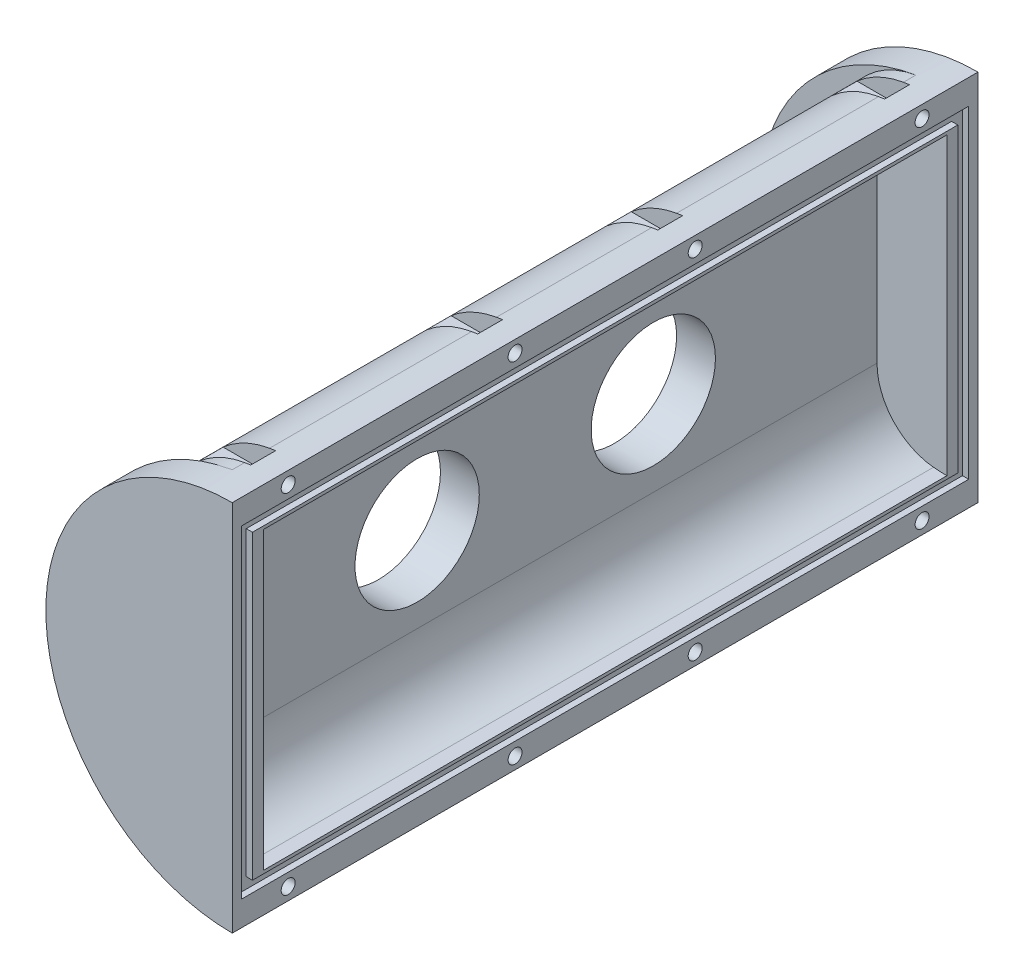
from build123d import *

# Parameters (mm, degrees)
BOSS_EXTRUDE1_DEPTH            = 110
BOSS_EXTRUDE3_START            = -110
BOSS_EXTRUDE3_DEPTH            = 10
SKETCH11_W                     = 8
SKETCH11_H                     = 7.702958
SKETCH11_H_2                   = 8
CUT_EXTRUDE1_DEPTH             = 51
M4_CLEARANCE_HOLE1_D           = 4.5
M4_CLEARANCE_HOLE1_CSINK_D     = 4.55
M4_CLEARANCE_HOLE1_CSINK_ANGLE = 90
CUT_EXTRUDE2_START             = -20
SKETCH14_R                     = 20
CUT_EXTRUDE2_DEPTH             = 48
CUT_EXTRUDE3_DEPTH             = 2
SKETCH22_W                     = 5
SKETCH22_H                     = 6


with BuildPart() as part:
    # Sketch1 → Boss-Extrude1 (new body)
    with BuildSketch(Plane.XY):
        with BuildLine():
            Line((0, 52), (-2, 52))
            Line((-2, 52), (-2, 48.5))
            Line((-2, 48.5), (0, 48.5))
            Line((0, 48.5), (0, 47.5))
            ThreePointArc((0, 47.5), (-2.161329, 47.450802), (-4.318182, 47.303312))
            ThreePointArc((-4.318182, 47.303312), (-17.270979, 40.870125), (-22.5, 27.386128))
            Line((-22.5, 27.386128), (-22.5, -27.386128))
            ThreePointArc((-22.5, -27.386128), (-17.270979, -40.870125), (-4.318182, -47.303312))
            ThreePointArc((-4.318182, -47.303312), (-2.161329, -47.450802), (0, -47.5))
            Line((0, -47.5), (0, -48.5))
            Line((0, -48.5), (-2, -48.5))
            Line((-2, -48.5), (-2, -52))
            Line((-2, -52), (0, -52))
            Line((0, -52), (0, -60))
            ThreePointArc((0, -60), (-5.017576, -59.789831), (-10, -59.160798))
            ThreePointArc((-10, -59.160798), (-27.912878, -48.945316), (-35, -29.580399))
            Line((-35, -29.580399), (-35, 29.580399))
            ThreePointArc((-35, 29.580399), (-27.912878, 48.945316), (-10, 59.160798))
            ThreePointArc((-10, 59.160798), (-5.017576, 59.789831), (0, 60))
            Line((0, 60), (0, 52))
        make_face()
    boss_extrude1 = extrude(amount=-BOSS_EXTRUDE1_DEPTH)

    # Sketch7 → Boss-Extrude3 (add)
    with BuildSketch(Plane.XY.offset(BOSS_EXTRUDE3_START)):
        with BuildLine():
            Line((0, 60), (0, -60))
            ThreePointArc((0, -60), (-60, 0), (0, 60))
        make_face()
    boss_extrude3 = extrude(amount=-BOSS_EXTRUDE3_DEPTH)

    # Sketch11 → Cut-Extrude1 (cut)
    with BuildSketch(Plane(origin=(-59.040249, 0, 0), x_dir=(0, 0, -1), z_dir=(-1, 0, 0))):
        with Locations((28.984104, 56.148521)):
            Rectangle(SKETCH11_W, SKETCH11_H)
        with Locations((102, 56)):
            Rectangle(SKETCH11_W, SKETCH11_H_2)
        with Locations((28.984104, -56.148521)):
            Rectangle(SKETCH11_W, SKETCH11_H)
        with Locations((102, -56)):
            Rectangle(SKETCH11_W, SKETCH11_H_2)
    cut_extrude1 = extrude(amount=-CUT_EXTRUDE1_DEPTH, mode=Mode.SUBTRACT)

    # M4 Clearance Hole1 (through all)
    with Locations(Plane.ZY.offset(35)):
        with Locations((-28.984104, -56.148521), (-102, 56), (-28.984104, 56.148521), (-102, -56)):
            m4_clearance_hole1 = CounterSinkHole(M4_CLEARANCE_HOLE1_D / 2, M4_CLEARANCE_HOLE1_CSINK_D / 2, counter_sink_angle=M4_CLEARANCE_HOLE1_CSINK_ANGLE)

    # Sketch14 → Cut-Extrude2 (cut)
    with BuildSketch(Plane(origin=(0, 0, 0), x_dir=(0, 0, -1), z_dir=(1, 0, 0)).offset(CUT_EXTRUDE2_START)):
        with Locations((38, 0)):
            Circle(SKETCH14_R)
    cut_extrude2 = extrude(amount=-CUT_EXTRUDE2_DEPTH, mode=Mode.SUBTRACT)

    # Sketch8 → Cut-Extrude3 (cut)
    with BuildSketch(Plane(origin=(0, 0, 0), x_dir=(0, 0, -1), z_dir=(1, 0, 0))):
        Polygon((117, 52), (117, -52), (110, -52), (110, -48.5), (113.5, -48.5), (113.5, 48.5), (110, 48.5), (110, 52), align=None)
    cut_extrude3 = extrude(amount=-CUT_EXTRUDE3_DEPTH, mode=Mode.SUBTRACT)

    # Sketch22 → Cut-Revolve4 (revolve, cut)
    with BuildSketch(Plane.XY.offset(-38)):
        with Locations((-32.5, -24)):
            Rectangle(SKETCH22_W, SKETCH22_H)
    cut_revolve4 = revolve(axis=Axis((-1035, 0, -38), (1, 0, 0)), mode=Mode.SUBTRACT)

    # Mirror3: Boss-Extrude1, Boss-Extrude3, Cut-Extrude1, M4 Clearance Hole1, Cut-Extrude2, Cut-Extrude3, Cut-Revolve4 across plane
    add(boss_extrude1.mirror(Plane.XY))
    add(boss_extrude3.mirror(Plane.XY))
    add(cut_extrude1.mirror(Plane.XY), mode=Mode.SUBTRACT)
    add(m4_clearance_hole1.mirror(Plane.XY), mode=Mode.SUBTRACT)
    add(cut_extrude2.mirror(Plane.XY), mode=Mode.SUBTRACT)
    add(cut_extrude3.mirror(Plane.XY), mode=Mode.SUBTRACT)
    add(cut_revolve4.mirror(Plane.XY), mode=Mode.SUBTRACT)


solid = part.part
